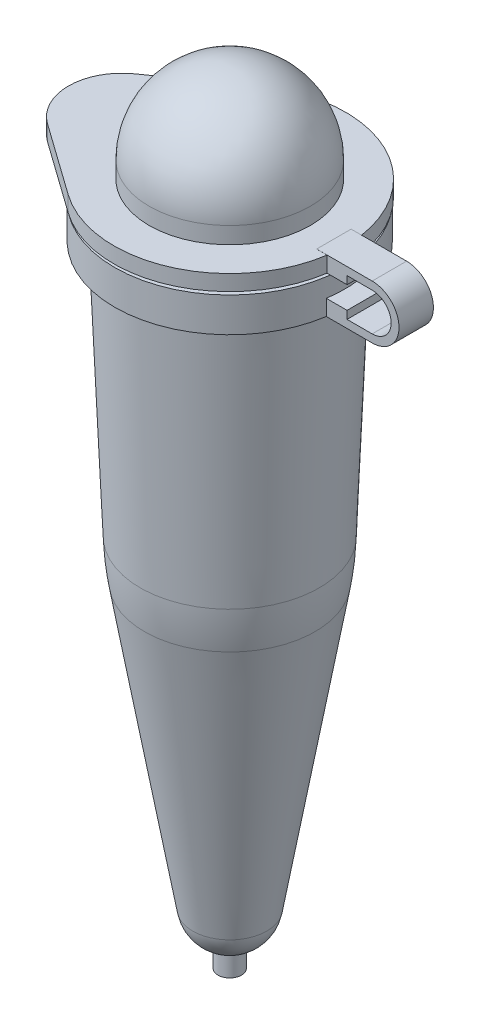
from build123d import *
from build123d.topology import SkipClean

# Parameters (mm, degrees)
SKETCH1_R           = 3.7338
SKETCH1_R_2         = 2.6797
BOSS_EXTRUDE1_DEPTH = 1.1176
SHELL1_T            = -0.5715
BOSS_EXTRUDE2_DEPTH = 0.5588
SKETCH4_R           = 2.615046293
SKETCH4_R_2         = 2.107046293
BOSS_EXTRUDE3_DEPTH = 1.1176
BOSS_EXTRUDE4_DEPTH = 0.508
SKETCH7_W           = 0.381
SKETCH7_H           = 0.933727322


with BuildPart() as part:
    # Sketch1 → Boss-Extrude1 (new body)
    with BuildSketch(Plane(origin=(0, 0, 0), x_dir=(1, 0, 0), z_dir=(0, 1, 0))):
        Circle(SKETCH1_R)
        Circle(SKETCH1_R_2, mode=Mode.SUBTRACT)
    extrude(amount=-BOSS_EXTRUDE1_DEPTH)


with BuildPart() as body_2:
    # Sketch2 → Revolve1 (revolve)
    with BuildSketch(Plane.XY):
        with BuildLine():
            Line((0, -1.1176), (0, -20.9296))
            ThreePointArc((0, -20.9296), (-0.789505828, -20.640890822), (-1.206518449, -19.910977871))
            Line((-1.206518449, -19.910977871), (-2.770770199, -10.714786652))
            ThreePointArc((-2.770770199, -10.714786652), (-2.859495986, -10.068144543), (-2.906518408, -9.4171398))
            Line((-2.906518408, -9.4171398), (-3.2385, -1.1176))
            Line((-3.2385, -1.1176), (0, -1.1176))
        make_face()
    revolve(axis=Axis((0, -1.1176, 0), (0, -1, 0)))

    # Shell1
    shell1_openings = [body_2.faces().sort_by_distance(p)[0] for p in [
        (0, -1.1176, 0),
    ]]
    offset(amount=SHELL1_T, openings=shell1_openings, kind=Kind.INTERSECTION)


with BuildPart() as part_1:
    add(part.part)

    # Combine1: union body 2
    add(body_2.part)

    # Sketch3 → Boss-Extrude2 (add, symmetric)
    with BuildSketch(Plane.XY):
        with BuildLine():
            Line((3.7338, -1.1176), (4.365322861, -1.1176))
            Line((4.365322861, -1.1176), (5.180035681, -1.1176))
            ThreePointArc((5.180035681, -1.1176), (6.050241958, -0.247393722), (5.180035681, 0.622812555))
            Line((5.180035681, 0.622812555), (4.365322861, 0.622812555))
            Line((4.365322861, 0.622812555), (3.379294532, 0.622812555))
            Line((3.379294532, 0.622812555), (3.379294532, 0.112660745))
            Line((3.379294532, 0.112660745), (4.365322861, 0.112660745))
            Line((4.365322861, 0.112660745), (4.365322861, 0.36773665))
            Line((4.365322861, 0.36773665), (5.180035681, 0.36773665))
            ThreePointArc((5.180035681, 0.36773665), (5.795166053, -0.247393722), (5.180035681, -0.862524095))
            Line((5.180035681, -0.862524095), (4.365322861, -0.862524095))
            Line((4.365322861, -0.862524095), (4.365322861, -0.607448189))
            Line((4.365322861, -0.607448189), (3.379294532, -0.607448189))
            Line((3.379294532, -0.607448189), (3.379294532, -1.1176))
            Line((3.379294532, -1.1176), (3.7338, -1.1176))
        make_face()
    extrude(amount=BOSS_EXTRUDE2_DEPTH, both=True)



with BuildPart() as body_2_2:
    # Sketch4 → Boss-Extrude3 (new body)
    with BuildSketch(Plane.XZ.offset(-0.112660745)):
        Circle(SKETCH4_R)
        Circle(SKETCH4_R_2, mode=Mode.SUBTRACT)
    extrude(amount=BOSS_EXTRUDE3_DEPTH)

    # Sketch5 → Revolve2 (revolve)
    with SkipClean():  # the faces are left unmerged after this step: merging them gives an invalid solid
        with BuildSketch(Plane.XY):
            with BuildLine():
                Line((-2.615046293, 0.112660745), (-2.615046293, 1.160799378))
                ThreePointArc((-2.615046293, 1.160799378), (-1.849116967, 3.009916345), (0, 3.775845671))
                Line((0, 3.775845671), (0, 3.267845671))
                ThreePointArc((0, 3.267845671), (-1.489906722, 2.6507061), (-2.107046293, 1.160799378))
                Line((-2.107046293, 1.160799378), (-2.107046293, 0.112660745))
                Line((-2.107046293, 0.112660745), (-2.107046293, 0.047504608))
                Line((-2.107046293, 0.047504608), (-2.615046293, 0.047504608))
                Line((-2.615046293, 0.047504608), (-2.615046293, 0.112660745))
            make_face()
        revolve(axis=Axis((0, 3.775845671, 0), (0, -1, 0)))
    add(body_2_2.part.scale(1), mode=Mode.REPLACE)  # the faces are merged on a copy


with BuildPart() as part_2:
    add(part_1.part)

    add(body_2_2.part)  # Boss-Extrude4 merges body 2 2
    # Sketch6 → Boss-Extrude4 (add)
    with BuildSketch(Plane.XZ.offset(-0.112660745)):
        with BuildLine():
            Line((-2.179935272, -3.062591525), (-4.50743423, -1.405890971))
            ThreePointArc((-4.50743423, -1.405890971), (-5.2324, 0), (-4.50743423, 1.405890971))
            Line((-4.50743423, 1.405890971), (-2.179935272, 3.062591525))
            ThreePointArc((-2.179935272, 3.062591525), (3.7592, 0), (-2.179935272, -3.062591525))
        make_face()
    extrude(amount=-BOSS_EXTRUDE4_DEPTH)

    # Sketch7 → Revolve3 (revolve)
    with BuildSketch(Plane.XY):
        with Locations((-0.1905, -21.097736339)):
            Rectangle(SKETCH7_W, SKETCH7_H)
    revolve(axis=Axis((0, -20.630872678, 0), (0, -1, 0)))


solid = part_2.part
